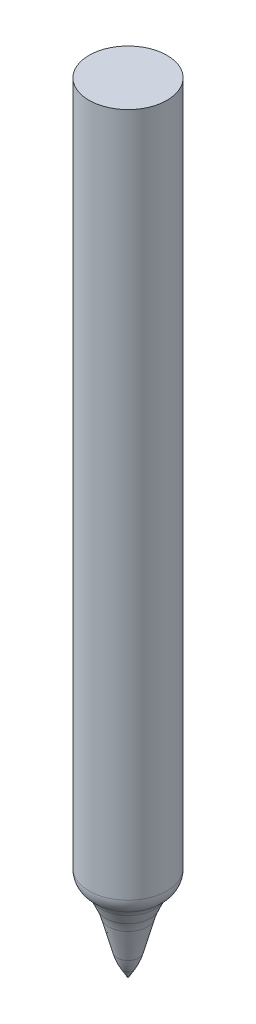
from build123d import *

# Parameters (mm, degrees)
FILLET1_R = 2.54
FILLET2_R = 2.54
FILLET3_R = 7.62


with BuildPart() as part:
    # Sketch1 → Revolve1 (revolve)
    with BuildSketch(Plane.XY, mode=Mode.PRIVATE) as revolve1_sk:
        Polygon((0, 0), (1.154700538, 2), (2.660575, 7.62), (3.81, 10.16), (5.08, 10.16), (5.08, 101.6), (0, 101.6), align=None)
    revolve(revolve1_sk.sketch.rotate(Axis((0, 0, 0), (0, 1, 0)), 90), axis=Axis((0, 0, 0), (0, 1, 0)))

    # Fillet1
    # the kernel refuses this fillet: 2.54 mm, written as the material it takes off along each edge
    with BuildSketch(Plane(origin=(0, 10.16, 0), x_dir=(0, 0, -1), z_dir=(1, 0, 0))) as fillet1_piece_1:
        with BuildLine():
            CenterArc((2.54, 2.199704526), FILLET1_R, 300, 60)
            Line((5.08, 2.199704526), (5.1308, 2.199704526))
            Line((5.1308, 2.199704526), (5.1308, 0))
            Line((5.1308, 0), (5.08, -0.0508))
            ThreePointArc((5.08, -0.0508), (4.445, -0.0508), (3.8354, -0.043994091))
            Line((3.8354, -0.043994091), (3.81, 0))
        make_face()
    revolve(axis=Axis((0, 10.16, 0), (0, 1, 0)), mode=Mode.SUBTRACT)

    # Fillet2
    fillet2_edges = [part.edges().sort_by_distance(p)[0] for p in [
        (0, 10.16, 3.81),
    ]]
    fillet(fillet2_edges, radius=FILLET2_R)

    # Fillet3
    fillet3_edges = [part.edges().sort_by_distance(p)[0] for p in [
        (0, 7.62, 2.660575),
        (0, 2, 1.154700538),
    ]]
    fillet(fillet3_edges, radius=FILLET3_R)


solid = part.part
